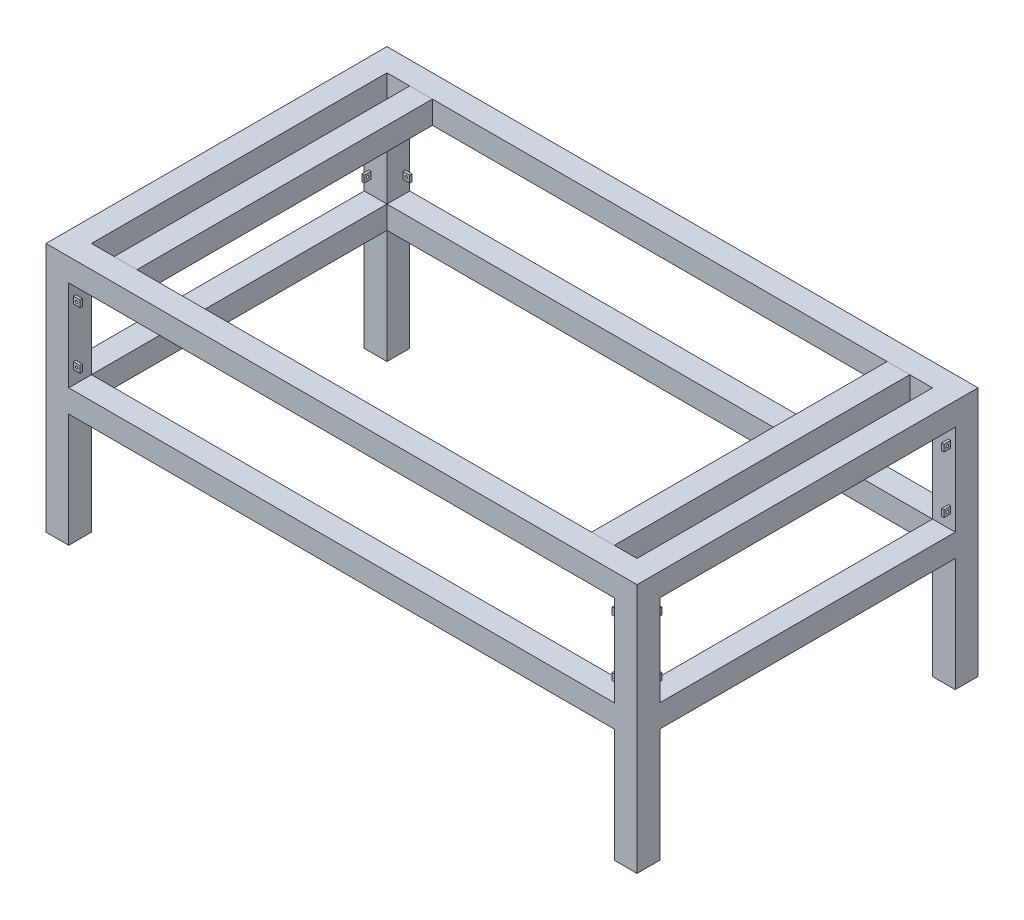
from build123d import *

# Parameters (mm, degrees)
ESQUISSE1_W             = 1300
ESQUISSE1_H             = 750
ESQUISSE1_W_2           = 1200
ESQUISSE1_H_2           = 650
BOSS_EXTRU_1_DEPTH      = 550
ESQUISSE2_W             = 1200
ESQUISSE2_H             = 200
ESQUISSE2_H_2           = 250
ENL_V_MAT_EXTRU_1_DEPTH = 1599.436736315
ESQUISSE3_W             = 650
ESQUISSE3_H             = 200
ESQUISSE3_H_2           = 250
ENL_V_MAT_EXTRU_2_DEPTH = 1599.436736315
ESQUISSE4_W             = 50
ESQUISSE4_H             = 650
BOSS_EXTRU_2_DEPTH      = 50
BOSS_EXTRU_2_2_DEPTH    = 50
ESQUISSE5_W             = 5
ESQUISSE5_H             = 15
BOSS_EXTRU_3_DEPTH      = 15
ESQUISSE6_W             = 5
ESQUISSE6_H             = 15
BOSS_EXTRU_4_DEPTH      = 15
ESQUISSE7_W             = 5
ESQUISSE7_H             = 15
BOSS_EXTRU_5_DEPTH      = 15
ESQUISSE8_W             = 5
ESQUISSE8_H             = 15
BOSS_EXTRU_6_DEPTH      = 15
ESQUISSE10_W            = 5
ESQUISSE10_H            = 15
BOSS_EXTRU_7_DEPTH      = 15
ESQUISSE12_W            = 5
ESQUISSE12_H            = 15
BOSS_EXTRU_8_DEPTH      = 15
ESQUISSE14_W            = 5
ESQUISSE14_H            = 15
BOSS_EXTRU_9_DEPTH      = 15
ESQUISSE15_W            = 5
ESQUISSE15_H            = 15
BOSS_EXTRU_10_DEPTH     = 15
ESQUISSE16_R            = 2.75
ENL_V_MAT_EXTRU_3_DEPTH = 1500
ESQUISSE17_R            = 2.75
ENL_V_MAT_EXTRU_4_DEPTH = 1000


with BuildPart() as part:
    # Esquisse1 → Boss.-Extru.1 (new body)
    with BuildSketch(Plane(origin=(0, 0, 0), x_dir=(1, 0, 0), z_dir=(0, 1, 0))):
        with Locations((650, 375)):
            Rectangle(ESQUISSE1_W, ESQUISSE1_H)
        with Locations((650, 375)):
            Rectangle(ESQUISSE1_W_2, ESQUISSE1_H_2, mode=Mode.SUBTRACT)
    extrude(amount=-BOSS_EXTRU_1_DEPTH)

    # Esquisse2 → Enlèv. mat.-Extru.1 (cut, through all)
    with BuildSketch(Plane.XY):
        with Locations((650, -150)):
            Rectangle(ESQUISSE2_W, ESQUISSE2_H)
        with Locations((650, -425)):
            Rectangle(ESQUISSE2_W, ESQUISSE2_H_2)
    extrude(amount=-ENL_V_MAT_EXTRU_1_DEPTH, mode=Mode.SUBTRACT)

    # Esquisse3 → Enlèv. mat.-Extru.2 (cut, through all)
    with BuildSketch(Plane.ZY):
        with Locations((-375, -150)):
            Rectangle(ESQUISSE3_W, ESQUISSE3_H)
        with Locations((-375, -425)):
            Rectangle(ESQUISSE3_W, ESQUISSE3_H_2)
    extrude(amount=-ENL_V_MAT_EXTRU_2_DEPTH, mode=Mode.SUBTRACT)

    # Esquisse5 → Boss.-Extru.3 (add)
    with BuildSketch(Plane.ZY.offset(-1250)):
        with Locations((-737.5, -87.5)):
            Rectangle(ESQUISSE5_W, ESQUISSE5_H)
        with Locations((-737.5, -212.5)):
            Rectangle(ESQUISSE5_W, ESQUISSE5_H)
    extrude(amount=BOSS_EXTRU_3_DEPTH)

    # Esquisse6 → Boss.-Extru.4 (add)
    with BuildSketch(Plane.XY.offset(-700)):
        with Locations((1287.5, -87.5)):
            Rectangle(ESQUISSE6_W, ESQUISSE6_H)
        with Locations((1287.5, -212.5)):
            Rectangle(ESQUISSE6_W, ESQUISSE6_H)
    extrude(amount=BOSS_EXTRU_4_DEPTH)

    # Esquisse7 → Boss.-Extru.5 (add)
    with BuildSketch(Plane(origin=(50, 0, 0), x_dir=(0, 0, -1), z_dir=(1, 0, 0))):
        with Locations((737.5, -87.5)):
            Rectangle(ESQUISSE7_W, ESQUISSE7_H)
        with Locations((737.5, -212.5)):
            Rectangle(ESQUISSE7_W, ESQUISSE7_H)
    extrude(amount=BOSS_EXTRU_5_DEPTH)

    # Esquisse8 → Boss.-Extru.6 (add)
    with BuildSketch(Plane.XY.offset(-700)):
        with Locations((12.5, -87.5)):
            Rectangle(ESQUISSE8_W, ESQUISSE8_H)
        with Locations((12.5, -212.5)):
            Rectangle(ESQUISSE8_W, ESQUISSE8_H)
    extrude(amount=BOSS_EXTRU_6_DEPTH)

    # Esquisse10 → Boss.-Extru.7 (add)
    with BuildSketch(Plane(origin=(50, 0, 0), x_dir=(0, 0, -1), z_dir=(1, 0, 0))):
        with Locations((12.5, -87.5)):
            Rectangle(ESQUISSE10_W, ESQUISSE10_H)
        with Locations((12.5, -212.5)):
            Rectangle(ESQUISSE10_W, ESQUISSE10_H)
    extrude(amount=BOSS_EXTRU_7_DEPTH)

    # Esquisse12 → Boss.-Extru.8 (add)
    with BuildSketch(Plane(origin=(0, 0, -50), x_dir=(-1, 0, 0), z_dir=(0, 0, -1))):
        with Locations((-12.5, -87.5)):
            Rectangle(ESQUISSE12_W, ESQUISSE12_H)
        with Locations((-12.5, -212.5)):
            Rectangle(ESQUISSE12_W, ESQUISSE12_H)
    extrude(amount=BOSS_EXTRU_8_DEPTH)

    # Esquisse14 → Boss.-Extru.9 (add)
    with BuildSketch(Plane.ZY.offset(-1250)):
        with Locations((-12.5, -87.5)):
            Rectangle(ESQUISSE14_W, ESQUISSE14_H)
        with Locations((-12.5, -212.5)):
            Rectangle(ESQUISSE14_W, ESQUISSE14_H)
    extrude(amount=BOSS_EXTRU_9_DEPTH)

    # Esquisse15 → Boss.-Extru.10 (add)
    with BuildSketch(Plane(origin=(0, 0, -50), x_dir=(-1, 0, 0), z_dir=(0, 0, -1))):
        with Locations((-1287.5, -87.5)):
            Rectangle(ESQUISSE15_W, ESQUISSE15_H)
        with Locations((-1287.5, -212.5)):
            Rectangle(ESQUISSE15_W, ESQUISSE15_H)
    extrude(amount=BOSS_EXTRU_10_DEPTH)

    # Esquisse16 → Enlèv. mat.-Extru.3 (cut)
    with BuildSketch(Plane(origin=(1290, 0, 0), x_dir=(0, 0, -1), z_dir=(1, 0, 0))):
        with Locations((57.5, -87.5)):
            Circle(ESQUISSE16_R)
        with Locations((57.5, -212.5)):
            Circle(ESQUISSE16_R)
        with Locations((692.5, -87.5)):
            Circle(ESQUISSE16_R)
        with Locations((692.5, -212.5)):
            Circle(ESQUISSE16_R)
    extrude(amount=-ENL_V_MAT_EXTRU_3_DEPTH, mode=Mode.SUBTRACT)

    # Esquisse17 → Enlèv. mat.-Extru.4 (cut)
    with BuildSketch(Plane.XY.offset(-10)):
        with Locations((57.5, -87.5)):
            Circle(ESQUISSE17_R)
        with Locations((57.5, -212.5)):
            Circle(ESQUISSE17_R)
        with Locations((1242.5, -212.5)):
            Circle(ESQUISSE17_R)
        with Locations((1242.5, -87.5)):
            Circle(ESQUISSE17_R)
    extrude(amount=-ENL_V_MAT_EXTRU_4_DEPTH, mode=Mode.SUBTRACT)


with BuildPart() as body_2:
    # Esquisse4 → Boss.-Extru.2 (new body)
    with BuildSketch(Plane(origin=(0, 0, 0), x_dir=(1, 0, 0), z_dir=(0, 1, 0))):
        with Locations((125, 375)):
            Rectangle(ESQUISSE4_W, ESQUISSE4_H)
    extrude(amount=-BOSS_EXTRU_2_DEPTH)


with BuildPart() as body_3:
    # Esquisse4 → Boss.-Extru.2 2 (new body)
    with BuildSketch(Plane(origin=(0, 0, 0), x_dir=(1, 0, 0), z_dir=(0, 1, 0))):
        with Locations((1175, 375)):
            Rectangle(ESQUISSE4_W, ESQUISSE4_H)
    extrude(amount=-BOSS_EXTRU_2_2_DEPTH)


solid = Compound([part.part, body_2.part, body_3.part])
